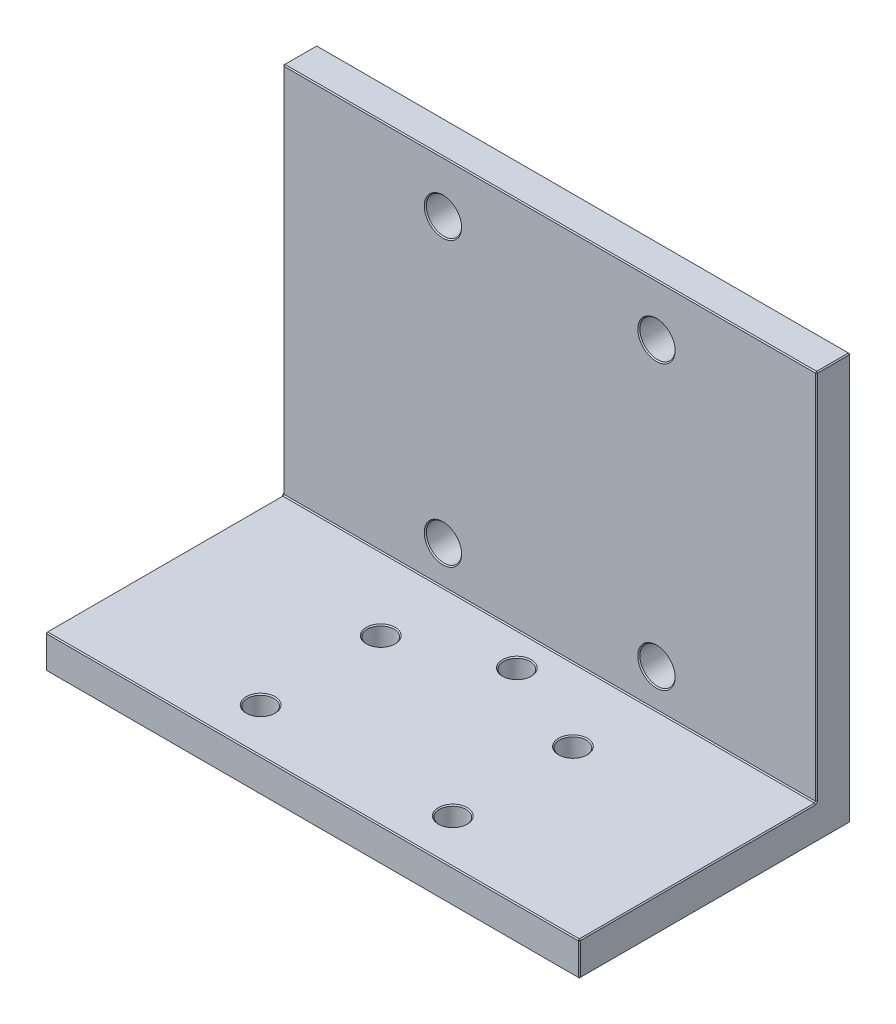
from build123d import *

# Parameters (mm, degrees)
BOSS_EXTRUDE1_DEPTH = 50
SKETCH2_R           = 3.3
CUT_EXTRUDE1_DEPTH  = 100
SKETCH3_R           = 2.5
CUT_EXTRUDE2_DEPTH  = 100
CHAMFER1_SIZE       = 0.2


with BuildPart() as part:
    # Sketch1 → Boss-Extrude1 (new, symmetric)
    with BuildSketch(Plane(origin=(0, 0, 0), x_dir=(0, 0, -1), z_dir=(1, 0, 0))):
        Polygon((0, 0), (0, 76.2), (-6.35, 76.2), (-6.35, 6.35), (-50.8, 6.35), (-50.8, 0), align=None)
    extrude(amount=BOSS_EXTRUDE1_DEPTH, both=True)

    # Sketch2 → Cut-Extrude1 (cut)
    with BuildSketch(Plane.XY.offset(6.35)):
        with Locations((-20, 66.5)):
            Circle(SKETCH2_R)
        with Locations((20, 66.5)):
            Circle(SKETCH2_R)
        with Locations((20, 13.5)):
            Circle(SKETCH2_R)
        with Locations((-20, 13.5)):
            Circle(SKETCH2_R)
    extrude(amount=-CUT_EXTRUDE1_DEPTH, mode=Mode.SUBTRACT)

    # Sketch3 → Cut-Extrude2 (cut)
    with BuildSketch(Plane(origin=(0, 6.35, 0), x_dir=(1, 0, 0), z_dir=(0, 1, 0))):
        with Locations((-18, -20)):
            Circle(SKETCH3_R)
        with Locations((-18, -42.5)):
            Circle(SKETCH3_R)
        with Locations((18, -42.5)):
            Circle(SKETCH3_R)
        with Locations((18, -20)):
            Circle(SKETCH3_R)
        with Locations((0, -12.5)):
            Circle(SKETCH3_R)
    extrude(amount=-CUT_EXTRUDE2_DEPTH, mode=Mode.SUBTRACT)

    # Chamfer1
    chamfer1_edges = [part.edges().sort_by_distance(p)[0] for p in [
        (-20.5, 6.35, 20),
        (-20.5, 6.35, 42.5),
        (15.5, 6.35, 42.5),
        (15.5, 6.35, 20),
        (-2.5, 6.35, 12.5),
        (-23.3, 66.5, 6.35),
        (16.7, 66.5, 6.35),
        (16.7, 13.5, 6.35),
        (-23.3, 13.5, 6.35),
        (50, 6.35, 28.575),
        (0, 6.35, 50.8),
        (-50, 6.35, 28.575),
        (0, 76.2, 6.35),
        (50, 41.275, 6.35),
        (0, 6.35, 6.35),
        (-50, 41.275, 6.35),
        (0, 0, 0),
        (0, 76.2, 0),
        (50, 3.175, 50.8),
        (50, 76.2, 3.175),
        (50, 38.1, 0),
        (50, 0, 25.4),
        (0, 0, 50.8),
        (-50, 3.175, 50.8),
        (-50, 76.2, 3.175),
        (-50, 38.1, 0),
        (-50, 0, 25.4),
        (-23.3, 66.5, 0),
        (16.7, 66.5, 0),
        (16.7, 13.5, 0),
        (-23.3, 13.5, 0),
        (-20.5, 0, 20),
        (-20.5, 0, 42.5),
        (15.5, 0, 42.5),
        (15.5, 0, 20),
        (-2.5, 0, 12.5),
    ]]
    chamfer(chamfer1_edges, length=CHAMFER1_SIZE)


solid = part.part
